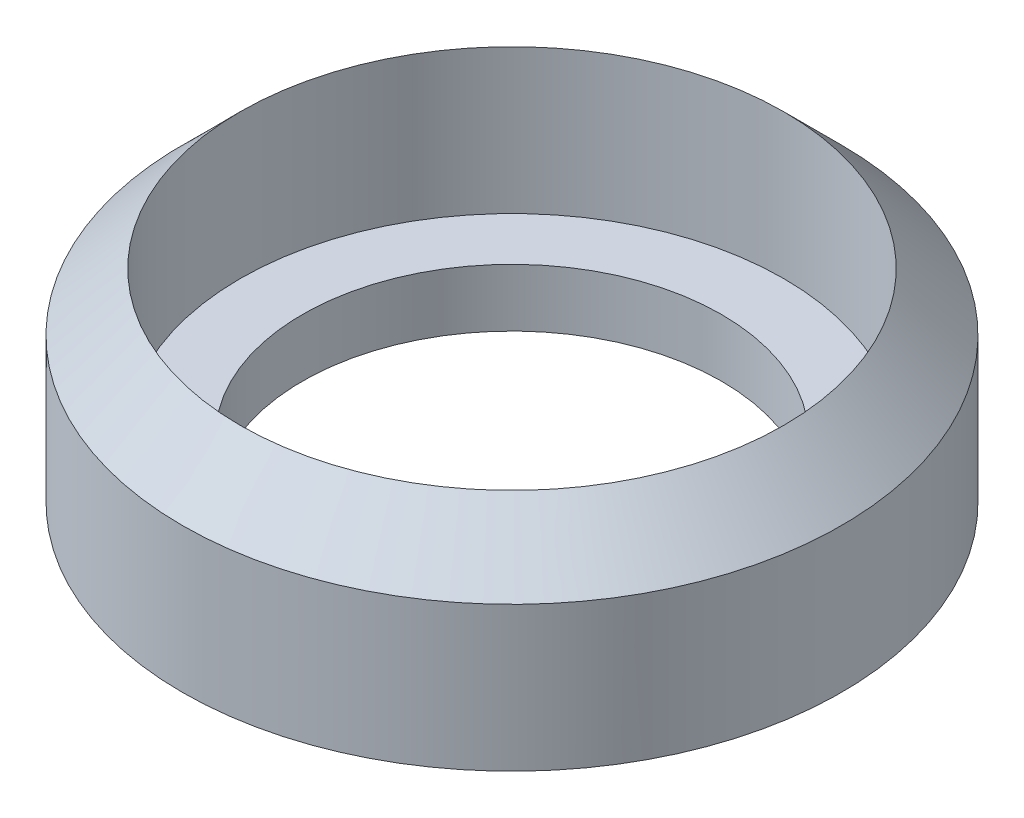
from build123d import *

# Parameters (mm, degrees)
CHAMFER1_SIZE = 10


with BuildPart() as part:
    # Sketch1 → Revolve1 (revolve)
    with BuildSketch(Plane.XY, mode=Mode.PRIVATE) as revolve1_sk:
        Polygon((36.25, 0), (36.25, 10), (47, 10), (47, 35), (57, 35), (57, 0), align=None)
    revolve(revolve1_sk.sketch.rotate(Axis((0, 630.278330928, 0), (0, -1, 0)), 90), axis=Axis((0, 630.278330928, 0), (0, -1, 0)))

    # Chamfer1
    chamfer1_edges = [part.edges().sort_by_distance(p)[0] for p in [
        (0, 35, -57),
    ]]
    chamfer(chamfer1_edges, length=CHAMFER1_SIZE - 0.0001)  # a hair under: the kernel refuses the full size


solid = part.part
